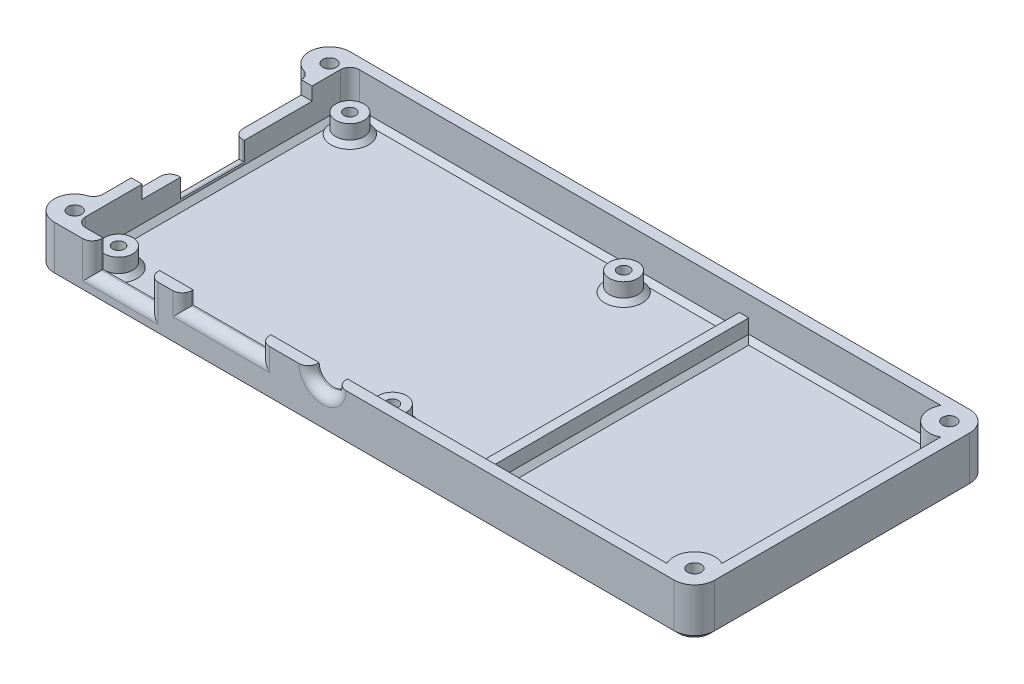
from build123d import *

# Parameters (mm, degrees)
SKETCH3_W                      = 135.6
SKETCH3_H                      = 62.6
SKETCH3_W_2                    = 131
SKETCH3_H_2                    = 58
BOSS_EXTRUDE1_DEPTH            = 10.3
SKETCH5_W                      = 131
SKETCH5_H                      = 58
BOSS_EXTRUDE2_DEPTH            = 2
SKETCH6_R                      = 3
BOSS_EXTRUDE3_DEPTH            = 4
F_2_5_2_5_DIAMETER_HOLE1_D     = 2.5
F_2_5_2_5_DIAMETER_HOLE1_DEPTH = 8
F_2_5_2_5_DIAMETER_HOLE1_TIP   = 0.751075774
SKETCH10_W                     = 2
SKETCH10_H                     = 58
BOSS_EXTRUDE4_DEPTH            = 4
CUT_EXTRUDE1_REACH             = 100.128
SKETCH11_R                     = 3
SKETCH11_W                     = 12
SKETCH11_H                     = 5.8
SKETCH11_W_2                   = 16.5
SKETCH11_H_2                   = 2.8
CUT_EXTRUDE2_REACH             = 142.276
SKETCH12_W                     = 13.5
SKETCH12_H                     = 6.8
SKETCH12_W_2                   = 36
SKETCH12_H_2                   = 2.8
FILLET6_R                      = 2
FILLET8_R                      = 2
CHAMFER1_SIZE                  = 1
FILLET9_R                      = 2
BOSS_EXTRUDE6_DEPTH            = 10.3
F_2_9_2_9_DIAMETER_HOLE2_D     = 2.9
F_2_9_2_9_DIAMETER_HOLE1_D     = 2.9
SKETCH24_R                     = 4.3
BOSS_EXTRUDE7_DEPTH            = 8.3
F_2_9_2_9_DIAMETER_HOLE5_D     = 2.9
F_2_9_2_9_DIAMETER_HOLE4_D     = 2.9
FILLET10_R                     = 4.3
FILLET18_R                     = 2
CHAMFER3_SIZE                  = 1
FILLET19_R                     = 2
FILLET20_R                     = 4.3
CHAMFER6_SIZE                  = 1
CHAMFER7_SIZE                  = 1


# Some blends are built 0.0001 mm under size
with BuildPart() as part:
    # Sketch3 → Boss-Extrude1 (new body)
    with BuildSketch(Plane(origin=(0, 0, 0), x_dir=(1, 0, 0), z_dir=(0, 1, 0))):
        with Locations((-7.061766162, 3.105993834)):
            Rectangle(SKETCH3_W, SKETCH3_H)
        with Locations((-7.061766162, 3.105993834)):
            Rectangle(SKETCH3_W_2, SKETCH3_H_2, mode=Mode.SUBTRACT)
    extrude(amount=BOSS_EXTRUDE1_DEPTH)

    # Sketch5 → Boss-Extrude2 (add)
    with BuildSketch(Plane(origin=(0, 0, 0), x_dir=(1, 0, 0), z_dir=(0, 1, 0))):
        with Locations((-7.061766162, 3.105993834)):
            Rectangle(SKETCH5_W, SKETCH5_H)
    extrude(amount=BOSS_EXTRUDE2_DEPTH)

    # Sketch6 → Boss-Extrude3 (add)
    with BuildSketch(Plane(origin=(0, 2, 0), x_dir=(1, 0, 0), z_dir=(0, 1, 0))):
        with Locations(Location((-68.061766162, 27.605993834, 0), (0, 0, 270))):
            Circle(SKETCH6_R)
        with Locations(Location((-68.061766162, -21.394006166, 0), (0, 0, 270))):
            Circle(SKETCH6_R)
        with Locations(Location((-10.061766162, -21.394006166, 0), (0, 0, 270))):
            Circle(SKETCH6_R)
        with Locations(Location((-10.061766162, 27.605993834, 0), (0, 0, 270))):
            Circle(SKETCH6_R)
    extrude(amount=BOSS_EXTRUDE3_DEPTH)

    # Ø2.5 (2.5) Diameter Hole1
    with Locations(Plane(origin=(0, 6, 0), x_dir=(1, 0, 0), z_dir=(0, 1, 0))):
        with Locations((-68.061766162, 27.605993834), (-10.061766162, 27.605993834), (-10.061766162, -21.394006166), (-68.061766162, -21.394006166)):
            Hole(F_2_5_2_5_DIAMETER_HOLE1_D / 2, depth=F_2_5_2_5_DIAMETER_HOLE1_DEPTH)
            with Locations((0, 0, -(F_2_5_2_5_DIAMETER_HOLE1_DEPTH + F_2_5_2_5_DIAMETER_HOLE1_TIP / 2))):  # 118° drill point
                Cone(0, F_2_5_2_5_DIAMETER_HOLE1_D / 2, F_2_5_2_5_DIAMETER_HOLE1_TIP, mode=Mode.SUBTRACT)

    # Sketch10 → Boss-Extrude4 (add)
    with BuildSketch(Plane(origin=(0, 2, 0), x_dir=(1, 0, 0), z_dir=(0, 1, 0))):
        with Locations((10.938233838, 3.105993834)):
            Rectangle(SKETCH10_W, SKETCH10_H)
    extrude(amount=BOSS_EXTRUDE4_DEPTH)

    # Sketch11 → Cut-Extrude1 (cut, up to next)
    with BuildSketch(Plane.XY.offset(28.194006166), mode=Mode.PRIVATE) as cut_extrude1_sk1:
        with Locations((-18.061766162, 10.3)):
            Circle(SKETCH11_R)
    cut_extrude1_tool1 = extrude(cut_extrude1_sk1.sketch, amount=-CUT_EXTRUDE1_REACH, mode=Mode.PRIVATE) & part.part
    # Sketch11 → Cut-Extrude1 (cut, up to next)
    with BuildSketch(Plane.XY.offset(28.194006166), mode=Mode.PRIVATE) as cut_extrude1_sk2:
        with Locations((-60.861766162, 7.4)):
            Rectangle(SKETCH11_W, SKETCH11_H)
    cut_extrude1_tool2 = extrude(cut_extrude1_sk2.sketch, amount=-CUT_EXTRUDE1_REACH, mode=Mode.PRIVATE) & part.part
    # Sketch11 → Cut-Extrude1 (cut, up to next)
    with BuildSketch(Plane.XY.offset(28.194006166), mode=Mode.PRIVATE) as cut_extrude1_sk3:
        with Locations((-39.527982648, 8.9)):
            Rectangle(SKETCH11_W_2, SKETCH11_H_2)
    cut_extrude1_tool3 = extrude(cut_extrude1_sk3.sketch, amount=-CUT_EXTRUDE1_REACH, mode=Mode.PRIVATE) & part.part
    add(cut_extrude1_tool1.solids().sort_by_distance((-18.061766, 10.3, 28.194006))[0], mode=Mode.SUBTRACT)
    add(cut_extrude1_tool2.solids().sort_by_distance((-60.861766, 7.4, 28.194006))[0], mode=Mode.SUBTRACT)
    add(cut_extrude1_tool3.solids().sort_by_distance((-39.527983, 8.9, 28.194006))[0], mode=Mode.SUBTRACT)

    # Sketch12 → Cut-Extrude2 (cut, up to next)
    with BuildSketch(Plane.ZY.offset(74.861766162), mode=Mode.PRIVATE) as cut_extrude2_sk1:
        with Locations((-2.982922372, 6.9)):
            Rectangle(SKETCH12_W, SKETCH12_H)
    cut_extrude2_tool1 = extrude(cut_extrude2_sk1.sketch, amount=-CUT_EXTRUDE2_REACH, mode=Mode.PRIVATE) & part.part
    # Sketch12 → Cut-Extrude2 (cut, up to next)
    with BuildSketch(Plane.ZY.offset(74.861766162), mode=Mode.PRIVATE) as cut_extrude2_sk2:
        with Locations((-6.105993834, 8.9)):
            Rectangle(SKETCH12_W_2, SKETCH12_H_2)
    cut_extrude2_tool2 = extrude(cut_extrude2_sk2.sketch, amount=-CUT_EXTRUDE2_REACH, mode=Mode.PRIVATE) & part.part
    add(cut_extrude2_tool1.solids().sort_by_distance((-74.861766, 6.9, -2.982922))[0], mode=Mode.SUBTRACT)
    add(cut_extrude2_tool2.solids().sort_by_distance((-74.861766, 8.9, -6.105994))[0], mode=Mode.SUBTRACT)

    # Fillet6
    fillet6_edges = [part.edges().sort_by_distance(p)[0] for p in [
        (58.438233838, 6.15, -32.105993834),
    ]]
    fillet(fillet6_edges, radius=FILLET6_R)

    # Fillet8
    fillet8_edges = [part.edges().sort_by_distance(p)[0] for p in [
        (-72.561766162, 6.15, -32.105993834),
        (-72.561766162, 6.15, 25.894006166),
    ]]
    fillet(fillet8_edges, radius=FILLET8_R)

    # Chamfer1
    chamfer1_edges = [part.edges().sort_by_distance(p)[0] for p in [
        (-68.061766162, 2, -30.605993834),
        (-68.061766162, 2, 18.394006166),
        (-10.061766162, 2, 18.394006166),
        (-10.061766162, 2, -30.605993834),
    ]]
    chamfer(chamfer1_edges, length=CHAMFER1_SIZE)

    # Fillet9
    fillet9_edges = [part.edges().sort_by_distance(p)[0] for p in [
        (-60.861766162, 4.5, 28.194006166),
        (-54.861766162, 7.4, 28.194006166),
        (-47.777982648, 8.9, 28.194006166),
        (-39.527982648, 7.5, 28.194006166),
        (-31.277982648, 8.9, 28.194006166),
        (-18.061766162, 7.3, 28.194006166),
        (-74.861766162, 5.5, -9.732922372),
        (-74.861766162, 3.5, -2.982922372),
        (-74.861766162, 5.5, 3.767077628),
    ]]
    fillet(fillet9_edges, radius=FILLET9_R)

    # Sketch17 → Boss-Extrude6 (add)
    with BuildSketch(Plane(origin=(0, 0, 0), x_dir=(1, 0, 0), z_dir=(0, 1, 0))):
        with BuildLine():
            Line((-74.861766162, 34.405993834), (-74.861766162, 25.805993834))
            ThreePointArc((-74.861766162, 25.805993834), (-79.161766162, 30.105993834), (-74.861766162, 34.405993834))
        make_face()
        with BuildLine():
            Line((-74.861766162, -19.594006166), (-74.861766162, -28.194006166))
            ThreePointArc((-74.861766162, -28.194006166), (-79.161766162, -23.894006166), (-74.861766162, -19.594006166))
        make_face()
    extrude(amount=BOSS_EXTRUDE6_DEPTH)

    # Ø2.9 (2.9) Diameter Hole2 (through all)
    with Locations(Plane(origin=(0, 10.3, 0), x_dir=(1, 0, 0), z_dir=(0, 1, 0))):
        with Locations((-74.861766162, 30.105993834)):
            Hole(F_2_9_2_9_DIAMETER_HOLE2_D / 2)

    # Ø2.9 (2.9) Diameter Hole1 (through all)
    with Locations(Plane(origin=(0, 10.3, 0), x_dir=(1, 0, 0), z_dir=(0, 1, 0))):
        with Locations((-74.861766162, -23.894006166)):
            Hole(F_2_9_2_9_DIAMETER_HOLE1_D / 2)

    # Sketch24 → Boss-Extrude7 (add)
    with BuildSketch(Plane(origin=(0, 2, 0), x_dir=(1, 0, 0), z_dir=(0, 1, 0))):
        with Locations((56.438233838, -23.894006166)):
            Circle(SKETCH24_R)
        with Locations((56.438233838, 30.105993834)):
            Circle(SKETCH24_R)
    extrude(amount=BOSS_EXTRUDE7_DEPTH)

    # Ø2.9 (2.9) Diameter Hole5 (through all)
    with Locations(Plane(origin=(0, 10.3, 0), x_dir=(1, 0, 0), z_dir=(0, 1, 0))):
        with Locations((56.438233838, -23.894006166)):
            Hole(F_2_9_2_9_DIAMETER_HOLE5_D / 2)

    # Ø2.9 (2.9) Diameter Hole4 (through all)
    with Locations(Plane(origin=(0, 10.3, 0), x_dir=(1, 0, 0), z_dir=(0, 1, 0))):
        with Locations((56.438233838, 30.105993834)):
            Hole(F_2_9_2_9_DIAMETER_HOLE4_D / 2)

    # Fillet10
    fillet10_edges = [part.edges().sort_by_distance(p)[0] for p in [
        (60.738233838, 5.15, -34.405993834),
    ]]
    fillet(fillet10_edges, radius=FILLET10_R - 0.0001)  # a hair under: the kernel refuses the full size

    # Fillet18
    fillet18_edges = [part.edges().sort_by_distance(p)[0] for p in [
        (-74.861766162, 5.15, -25.805993834),
        (-74.861766162, 5.15, 19.594006166),
    ]]
    fillet(fillet18_edges, radius=FILLET18_R)

    # Chamfer3
    chamfer3_edges = [part.edges().sort_by_distance(p)[0] for p in [
        (-79.105793795, 0, -30.797535193),
        (-9.211716162, 0, -34.405993834),
        (59.478822286, 0, -33.146582283),
        (-79.105793795, 0, 24.585547524),
        (-74.861766162, 0, -3.105993834),
        (-75.2385223, 0, 19.088261462),
        (-75.2385223, 0, -25.300249131),
        (60.738233838, 0, -0.956043834),
        (-7.061766162, 0, 28.194006166),
    ]]
    chamfer(chamfer3_edges, length=CHAMFER3_SIZE)

    # Fillet19
    fillet19_edges = [part.edges().sort_by_distance(p)[0] for p in [
        (-66.861766162, 6.4, 28.194006166),
    ]]
    fillet(fillet19_edges, radius=FILLET19_R)

    # Fillet20
    # the kernel refuses this fillet: 4.3 mm, written as the material it takes off along each edge
    with BuildSketch(Plane(origin=(60.738233838, -9.75, 28.194006166), x_dir=(-1, 0, 0), z_dir=(0, 1, 0))) as fillet20_piece_1:
        with BuildLine():
            CenterArc((FILLET20_R, -FILLET20_R), FILLET20_R, 90, 90)
            Line((0, -FILLET20_R), (0, 0))
            Line((0, 0), (FILLET20_R, 0))
        make_face()
    extrude(amount=30.8, mode=Mode.SUBTRACT)

    # Chamfer5
    # the kernel refuses this chamfer: 1 mm, written as the material it adds along each edge
    with BuildSketch(Plane(origin=(-72.561766162, 2, 23.894006166), x_dir=(-0.027495876610568366, 0.9996219169112972, 0), z_dir=(0, 0, -1))) as chamfer5_piece_1:
        with BuildLine():
            Line((1.028673195, 0), (-0.056547155, 1.027117794))
            Line((-0.056547155, 1.027117794), (-0.076539593, 1.026567876))
            ThreePointArc((-0.076539593, 1.026567876), (-0.034129227, 0.51339783), (-0.019992438, -0.000549918))
            Line((-0.019992438, -0.000549918), (0.000549918, -0.019992438))
            ThreePointArc((0.000549918, -0.019992438), (0.514497665, -0.00585565), (1.029223113, -0.019992438))
            Line((1.029223113, -0.019992438), (1.028673195, 0))
        make_face()
    extrude(amount=54)
    with BuildSketch(Plane(origin=(-70.561766162, 2, 23.894006166), x_dir=(0, 0, 1), z_dir=(1, 0, 0))) as chamfer5_piece_2:
        with BuildLine():
            Line((0.971715729, 0.028284271), (2.028284271, -1.028284271))
            Line((2.028284271, -1.028284271), (2.048284271, -1.028284271))
            ThreePointArc((2.048284271, -1.028284271), (2.02, -0.514142136), (2.02, 0))
            Line((2.02, 0), (2, 0.02))
            ThreePointArc((2, 0.02), (1.485857864, 0.02), (0.971715729, 0.048284271))
            Line((0.971715729, 0.048284271), (0.971715729, 0.028284271))
        make_face()
    revolve(axis=Axis((-70.561766162, 2, 23.894006166), (0, -1, 0)), revolution_arc=90)
    with BuildSketch(Plane(origin=(-70.561766162, 2, -30.105993834), x_dir=(0, 0, -1), z_dir=(1, 0, 0))) as chamfer5_piece_3:
        with BuildLine():
            Line((2.028284271, 1.028284271), (0.971715729, -0.028284271))
            Line((0.971715729, -0.028284271), (0.971715729, -0.048284271))
            ThreePointArc((0.971715729, -0.048284271), (1.485857864, -0.02), (2, -0.02))
            Line((2, -0.02), (2.02, 0))
            ThreePointArc((2.02, 0), (2.02, 0.514142136), (2.048284271, 1.028284271))
            Line((2.048284271, 1.028284271), (2.028284271, 1.028284271))
        make_face()
    revolve(axis=Axis((-70.561766162, 2, -30.105993834), (0, 1, 0)), revolution_arc=90)
    with BuildSketch(Plane(origin=(9.938233838, 2, 25.894006166), x_dir=(0, 0.9996219169112968, 0.027495876610585623), z_dir=(-1, 0, 0)), Plane(origin=(-70.561766162, 2, -32.105993834), x_dir=(0, 0.9996219169112968, -0.027495876610589075), z_dir=(1, 0, 0))) as chamfer5_piece_4:
        with BuildLine():
            Line((1.028673195, 0), (-0.056547155, 1.027117794))
            Line((-0.056547155, 1.027117794), (-0.076539593, 1.026567876))
            ThreePointArc((-0.076539593, 1.026567876), (-0.034129227, 0.51339783), (-0.019992438, -0.000549918))
            Line((-0.019992438, -0.000549918), (0.000549918, -0.019992438))
            ThreePointArc((0.000549918, -0.019992438), (0.514497665, -0.00585565), (1.029223113, -0.019992438))
            Line((1.029223113, -0.019992438), (1.028673195, 0))
        make_face()
    extrude(amount=80.5)
    with BuildSketch(Plane(origin=(9.938233838, 2, 25.894006166), x_dir=(0.027495876610585623, 0.9996219169112968, 0), z_dir=(0, 0, -1)), Plane(origin=(11.938233838, 2, -32.105993834), x_dir=(-0.027495876610585623, 0.9996219169112968, 0), z_dir=(0, 0, 1))) as chamfer5_piece_5:
        with BuildLine():
            Line((1.028673195, 0), (-0.056547155, -1.027117794))
            Line((-0.056547155, -1.027117794), (-0.076539593, -1.026567876))
            ThreePointArc((-0.076539593, -1.026567876), (-0.034129227, -0.51339783), (-0.019992438, 0.000549918))
            Line((-0.019992438, 0.000549918), (0.000549918, 0.019992438))
            ThreePointArc((0.000549918, 0.019992438), (0.514497665, 0.00585565), (1.029223113, 0.019992438))
            Line((1.029223113, 0.019992438), (1.028673195, 0))
        make_face()
    extrude(amount=58)
    with BuildSketch(Plane(origin=(11.938233838, 2, -32.105993834), x_dir=(0, 0.9996219169112968, -0.027495876610589075), z_dir=(1, 0, 0))) as chamfer5_piece_6_section:
        with BuildLine():
            Line((1.028673195, 0), (-0.056547155, 1.027117794))
            Line((-0.056547155, 1.027117794), (-0.076539593, 1.026567876))
            ThreePointArc((-0.076539593, 1.026567876), (-0.034129227, 0.51339783), (-0.019992438, -0.000549918))
            Line((-0.019992438, -0.000549918), (0.000549918, -0.019992438))
            ThreePointArc((0.000549918, -0.019992438), (0.514497665, -0.00585565), (1.029223113, -0.019992438))
            Line((1.029223113, -0.019992438), (1.028673195, 0))
        make_face()
    chamfer5_piece_6 = extrude(amount=43.265109726, mode=Mode.PRIVATE)
    chamfer5_piece_6 = chamfer5_piece_6 - Plane(origin=(56.438233838, 2.330131969, -30.105993834), x_dir=(1, 0, 0), z_dir=(0, -1, 0)) * Cylinder(4.3, 91, mode=Mode.PRIVATE)
    add(chamfer5_piece_6)
    with BuildSketch(Plane(origin=(9.938233838, 2, 28.465689154), x_dir=(0.027495876610585623, 0.9996219169112968, 0), z_dir=(0, 0, -1))) as chamfer5_piece_7a_section:
        with BuildLine():
            Line((1.028673195, 0), (-0.056547155, -1.027117794))
            Line((-0.056547155, -1.027117794), (-0.076539593, -1.026567876))
            ThreePointArc((-0.076539593, -1.026567876), (-0.034129227, -0.51339783), (-0.019992438, 0.000549918))
            Line((-0.019992438, 0.000549918), (0.000549918, 0.019992438))
            ThreePointArc((0.000549918, 0.019992438), (0.514497665, 0.00585565), (1.029223113, 0.019992438))
            Line((1.029223113, 0.019992438), (1.028673195, 0))
        make_face()
    chamfer5_piece_7a = extrude(amount=60.571682988, mode=Mode.PRIVATE)
    chamfer5_piece_7a = split(chamfer5_piece_7a, bisect_by=Plane(origin=(9.608440211, 2.329793627, 25.894006166), z_dir=(0, 0, 1)), keep=Keep.TOP, mode=Mode.PRIVATE)
    with BuildSketch(Plane(origin=(12.509916826, 2, 25.894006166), x_dir=(0, 0.9996219169112968, 0.027495876610585623), z_dir=(-1, 0, 0))) as chamfer5_piece_7b_section:
        with BuildLine():
            Line((1.028673195, 0), (-0.056547155, 1.027117794))
            Line((-0.056547155, 1.027117794), (-0.076539593, 1.026567876))
            ThreePointArc((-0.076539593, 1.026567876), (-0.034129227, 0.51339783), (-0.019992438, -0.000549918))
            Line((-0.019992438, -0.000549918), (0.000549918, -0.019992438))
            ThreePointArc((0.000549918, -0.019992438), (0.514497665, -0.00585565), (1.029223113, -0.019992438))
            Line((1.029223113, -0.019992438), (1.028673195, 0))
        make_face()
    chamfer5_piece_7b = extrude(amount=83.071682988, mode=Mode.PRIVATE)
    chamfer5_piece_7b = split(chamfer5_piece_7b, bisect_by=Plane(origin=(9.938233838, 2.329793627, 25.564212539), z_dir=(1, 0, 0)), keep=Keep.TOP, mode=Mode.PRIVATE)
    chamfer5_piece_7 = chamfer5_piece_7a & chamfer5_piece_7b
    add(chamfer5_piece_7)
    with BuildSketch(Plane(origin=(-70.561766162, 2, -32.105993834), x_dir=(0, 0.9996219169112968, -0.027495876610589075), z_dir=(1, 0, 0))) as chamfer5_piece_8a_section:
        with BuildLine():
            Line((1.028673195, 0), (-0.056547155, 1.027117794))
            Line((-0.056547155, 1.027117794), (-0.076539593, 1.026567876))
            ThreePointArc((-0.076539593, 1.026567876), (-0.034129227, 0.51339783), (-0.019992438, -0.000549918))
            Line((-0.019992438, -0.000549918), (0.000549918, -0.019992438))
            ThreePointArc((0.000549918, -0.019992438), (0.514497665, -0.00585565), (1.029223113, -0.019992438))
            Line((1.029223113, -0.019992438), (1.028673195, 0))
        make_face()
    chamfer5_piece_8a = extrude(amount=83.071682988, mode=Mode.PRIVATE)
    chamfer5_piece_8a = split(chamfer5_piece_8a, bisect_by=Plane(origin=(9.938233838, 2.329793627, -31.776200208), z_dir=(1, 0, 0)), keep=Keep.TOP, mode=Mode.PRIVATE)
    with BuildSketch(Plane(origin=(9.938233838, 2, 25.894006166), x_dir=(0.027495876610585623, 0.9996219169112968, 0), z_dir=(0, 0, -1))) as chamfer5_piece_8b_section:
        with BuildLine():
            Line((1.028673195, 0), (-0.056547155, -1.027117794))
            Line((-0.056547155, -1.027117794), (-0.076539593, -1.026567876))
            ThreePointArc((-0.076539593, -1.026567876), (-0.034129227, -0.51339783), (-0.019992438, 0.000549918))
            Line((-0.019992438, 0.000549918), (0.000549918, 0.019992438))
            ThreePointArc((0.000549918, 0.019992438), (0.514497665, 0.00585565), (1.029223113, 0.019992438))
            Line((1.029223113, 0.019992438), (1.028673195, 0))
        make_face()
    chamfer5_piece_8b = extrude(amount=60.571682988, mode=Mode.PRIVATE)
    chamfer5_piece_8b = split(chamfer5_piece_8b, bisect_by=Plane(origin=(9.608440211, 2.329793627, -32.105993834), z_dir=(0, 0, -1)), keep=Keep.TOP, mode=Mode.PRIVATE)
    chamfer5_piece_8 = chamfer5_piece_8a & chamfer5_piece_8b
    add(chamfer5_piece_8)
    with BuildSketch(Plane(origin=(9.36655085, 2, -32.105993834), x_dir=(0, 0.9996219169112968, -0.027495876610589075), z_dir=(1, 0, 0))) as chamfer5_piece_9a_section:
        with BuildLine():
            Line((1.028673195, 0), (-0.056547155, 1.027117794))
            Line((-0.056547155, 1.027117794), (-0.076539593, 1.026567876))
            ThreePointArc((-0.076539593, 1.026567876), (-0.034129227, 0.51339783), (-0.019992438, -0.000549918))
            Line((-0.019992438, -0.000549918), (0.000549918, -0.019992438))
            ThreePointArc((0.000549918, -0.019992438), (0.514497665, -0.00585565), (1.029223113, -0.019992438))
            Line((1.029223113, -0.019992438), (1.028673195, 0))
        make_face()
    chamfer5_piece_9a = extrude(amount=45.836792714, mode=Mode.PRIVATE)
    chamfer5_piece_9a = split(chamfer5_piece_9a, bisect_by=Plane(origin=(11.938233838, 2.329793627, -31.776200208), z_dir=(-1, 0, 0)), keep=Keep.TOP, mode=Mode.PRIVATE)
    with BuildSketch(Plane(origin=(11.938233838, 2, -34.677676822), x_dir=(-0.027495876610585623, 0.9996219169112968, 0), z_dir=(0, 0, 1))) as chamfer5_piece_9b_section:
        with BuildLine():
            Line((1.028673195, 0), (-0.056547155, -1.027117794))
            Line((-0.056547155, -1.027117794), (-0.076539593, -1.026567876))
            ThreePointArc((-0.076539593, -1.026567876), (-0.034129227, -0.51339783), (-0.019992438, 0.000549918))
            Line((-0.019992438, 0.000549918), (0.000549918, 0.019992438))
            ThreePointArc((0.000549918, 0.019992438), (0.514497665, 0.00585565), (1.029223113, 0.019992438))
            Line((1.029223113, 0.019992438), (1.028673195, 0))
        make_face()
    chamfer5_piece_9b = extrude(amount=60.571682988, mode=Mode.PRIVATE)
    chamfer5_piece_9b = split(chamfer5_piece_9b, bisect_by=Plane(origin=(12.268027465, 2.329793627, -32.105993834), z_dir=(0, 0, -1)), keep=Keep.TOP, mode=Mode.PRIVATE)
    chamfer5_piece_9 = chamfer5_piece_9a & chamfer5_piece_9b
    add(chamfer5_piece_9)

    # Chamfer6
    chamfer6_edges = [part.edges().sort_by_distance(p)[0] for p in [
        (58.438233838, 2, -3.105993834),
    ]]
    chamfer(chamfer6_edges, length=CHAMFER6_SIZE)

    # Chamfer7
    chamfer7_edges = [part.edges().sort_by_distance(p)[0] for p in [
        (59.478792997, 0, 26.934565325),
    ]]
    chamfer(chamfer7_edges, length=CHAMFER7_SIZE - 0.0001)  # a hair under: the kernel refuses the full size


solid = part.part
